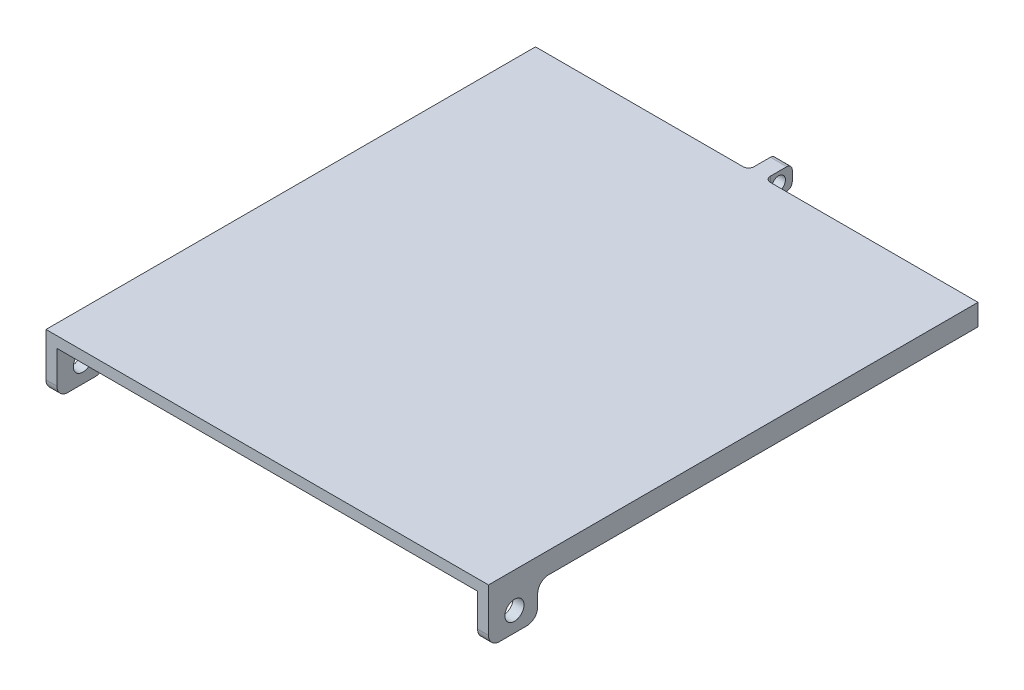
from build123d import *

# Parameters (mm, degrees)
BOSS_EXTRUDE2_DEPTH      = 8
SKETCH2_W                = 81
SKETCH2_H                = 89.6
BOSS_EXTRUDE3_DEPTH      = 2
SKETCH3_R                = 1.75
CUT_EXTRUDE1_DEPTH       = 125.5538661
CUT_EXTRUDE2_DEPTH       = 124.262587838
CUT_EXTRUDE2_DEPTH_BACK  = 124.262587838
SKETCH4_W                = 80.6
SKETCH4_H                = 6.1
SKETCH5_W                = 68.8
SKETCH5_H                = 1.2
BOSS_EXTRUDE4_DEPTH      = 2
FILLET2_R                = 2
BOSS_EXTRUDE5_DEPTH      = 1.5
BOSS_EXTRUDE5_DEPTH_BACK = 1.5
SKETCH7_R                = 1.25
FILLET5_R                = 1


with BuildPart() as part:
    # Sketch1 → Boss-Extrude2 (new body)
    with BuildSketch(Plane(origin=(0, 0, 0), x_dir=(1, 0, 0), z_dir=(0, 1, 0))):
        Polygon((-46.14154214, 4.488604838), (-46.14154214, 13.488604838), (-46.14154214, 92.088604838), (30.85845786, 92.088604838), (30.85845786, 13.488604838), (30.85845786, 4.488604838), (32.85845786, 4.488604838), (32.85845786, 94.088604838), (-48.14154214, 94.088604838), (-48.14154214, 4.488604838), align=None)
    extrude(amount=BOSS_EXTRUDE2_DEPTH)

    # Sketch2 → Boss-Extrude3 (add)
    with BuildSketch(Plane(origin=(0, 8, 0), x_dir=(1, 0, 0), z_dir=(0, 1, 0))):
        with Locations((-7.64154214, 49.288604838)):
            Rectangle(SKETCH2_W, SKETCH2_H)
    extrude(amount=BOSS_EXTRUDE3_DEPTH)

    # Sketch3 → Cut-Extrude1 (cut, through all)
    with BuildSketch(Plane(origin=(32.85845786, 0, 0), x_dir=(0, 0, -1), z_dir=(1, 0, 0))):
        with Locations((9.238604838, 3.6)):
            Circle(SKETCH3_R)
    extrude(amount=-CUT_EXTRUDE1_DEPTH, mode=Mode.SUBTRACT)

    # Sketch4 → Cut-Extrude2 (cut, two sides: drawn at the far end of the back side and taken through both)
    with BuildSketch(Plane.ZY.offset(-30.85845786).offset(-CUT_EXTRUDE2_DEPTH_BACK)):
        with Locations((-53.788604838, 3.05)):
            Rectangle(SKETCH4_W, SKETCH4_H)
    extrude(amount=CUT_EXTRUDE2_DEPTH + CUT_EXTRUDE2_DEPTH_BACK, mode=Mode.SUBTRACT)

    # Sketch5 → Boss-Extrude4 (add)
    with BuildSketch(Plane.XZ.offset(-8)):
        with Locations((-7.64154214, -12.405302831)):
            Rectangle(SKETCH5_W, SKETCH5_H)
    extrude(amount=BOSS_EXTRUDE4_DEPTH)

    # Fillet2
    fillet2_edges = [part.edges().sort_by_distance(p)[0] for p in [
        (-7.64154214, 8, -11.805302831),
        (-47.14154214, 0, -4.488604838),
        (-47.14154214, 0, -13.488604838),
        (-47.14154214, 6.1, -13.488604838),
        (31.85845786, 6.1, -13.488604838),
        (31.85845786, 0, -4.488604838),
        (31.85845786, 0, -13.488604838),
    ]]
    fillet(fillet2_edges, radius=FILLET2_R - 0.0001)  # a hair under: the kernel refuses the full size

    # Sketch7 → Boss-Extrude5 (add, two sides: drawn at the far end of the back side and taken through both)
    with BuildSketch(Plane.ZY.offset(7.64154214).offset(-BOSS_EXTRUDE5_DEPTH_BACK)):
        with BuildLine():
            Line((-94.088604838, 10), (-98.088604838, 10))
            ThreePointArc((-98.088604838, 10), (-98.79571162, 9.707106781), (-99.088604838, 9))
            Line((-99.088604838, 9), (-99.088604838, 7.1))
            ThreePointArc((-99.088604838, 7.1), (-98.79571162, 6.392893219), (-98.088604838, 6.1))
            Line((-98.088604838, 6.1), (-94.088604838, 6.1))
            Line((-94.088604838, 6.1), (-94.088604838, 10))
        make_face()
        with Locations((-96.588604838, 8.05)):
            Circle(SKETCH7_R, mode=Mode.SUBTRACT)
    extrude(amount=BOSS_EXTRUDE5_DEPTH + BOSS_EXTRUDE5_DEPTH_BACK)

    # Fillet5
    fillet5_edges = [part.edges().sort_by_distance(p)[0] for p in [
        (-6.14154214, 8.05, -94.088604838),
        (-9.14154214, 8.05, -94.088604838),
    ]]
    fillet(fillet5_edges, radius=FILLET5_R)


solid = part.part
